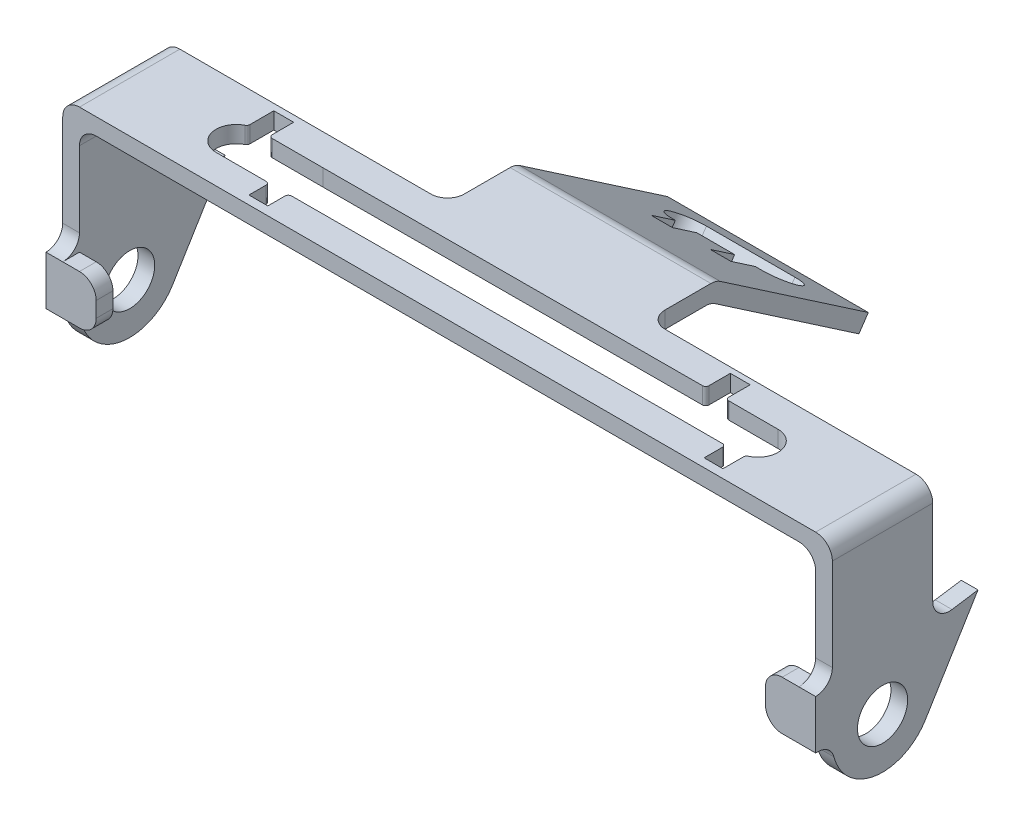
from build123d import *

# Parameters (mm, degrees)
SKETCH1_W           = 220
SKETCH1_H           = 30
BOSS_EXTRUDE1_DEPTH = 5
SKETCH2_W           = 30
SKETCH2_H           = 70
BOSS_EXTRUDE2_DEPTH = 5
CUT_EXTRUDE1_DEPTH  = 10
BOSS_EXTRUDE3_DEPTH = 5
BOSS_EXTRUDE4_DEPTH = 30
FILLET1_R           = 5
SKETCH7_R           = 7.5
CUT_EXTRUDE2_DEPTH  = 253
SKETCH8_W           = 15
SKETCH8_H           = 14.618243145
BOSS_EXTRUDE5_DEPTH = 5
FILLET2_R           = 5
CUT_EXTRUDE3_DEPTH  = 5
SKETCH10_W          = 5.944140112
SKETCH10_H          = 11.167837108
SKETCH10_W_2        = 5.92832961
SKETCH10_H_2        = 9.506983552
CUT_EXTRUDE4_DEPTH  = 5
SKETCH11_W          = 5.623434756
SKETCH11_H          = 8.337110403
SKETCH11_W_2        = 5.64698147
SKETCH11_H_2        = 9.10404701
CUT_EXTRUDE5_DEPTH  = 5
FILLET3_R           = 1
CUT_EXTRUDE6_DEPTH  = 5
SKETCH13_W          = 6.176524638
SKETCH13_H          = 11.481735796
SKETCH13_W_2        = 6.413794009
SKETCH13_H_2        = 10.832022022
CUT_EXTRUDE7_DEPTH  = 5


with BuildPart() as part:
    # Sketch1 → Boss-Extrude1 (new body)
    with BuildSketch(Plane(origin=(0, 0, 0), x_dir=(1, 0, 0), z_dir=(0, 1, 0))):
        Rectangle(SKETCH1_W, SKETCH1_H)
    extrude(amount=BOSS_EXTRUDE1_DEPTH)

    # Sketch2 → Boss-Extrude2 (add)
    with BuildSketch(Plane.ZY.offset(110)):
        with Locations((0, -30)):
            Rectangle(SKETCH2_W, SKETCH2_H)
    boss_extrude2 = extrude(amount=BOSS_EXTRUDE2_DEPTH)

    # Mirror1: Boss-Extrude2 across plane
    add(boss_extrude2.mirror(Plane(origin=(0, 0, 0), x_dir=(0, 0, 1), z_dir=(1, 0, 0))))

    # Sketch4 → Cut-Extrude1 (cut)
    with BuildSketch(Plane.ZY.offset(115)):
        with BuildLine():
            Line((-15, -47.167473829), (-15, -65))
            Line((-15, -65), (15, -65))
            Line((15, -65), (15, -47.167473829))
            ThreePointArc((15, -47.167473829), (0, -62.167473829), (-15, -47.167473829))
        make_face()
    cut_extrude1 = extrude(amount=-CUT_EXTRUDE1_DEPTH, mode=Mode.SUBTRACT)

    # Mirror2: Cut-Extrude1 across plane
    add(cut_extrude1.mirror(Plane(origin=(0, 0, 0), x_dir=(0, 0, 1), z_dir=(1, 0, 0))), mode=Mode.SUBTRACT)

    # Sketch5 → Boss-Extrude3 (add)
    with BuildSketch(Plane(origin=(115, 0, 0), x_dir=(0, 0, -1), z_dir=(1, 0, 0))):
        with BuildLine():
            Line((28.523256762, -29.22115135), (15, -31.288780588))
            Line((15, -31.288780588), (-5.201478884, -40.890888071))
            Line((-5.201478884, -40.890888071), (-4.123987776, -59.07486744))
            Line((-4.123987776, -59.07486744), (0, -62.167473829))
            ThreePointArc((0, -62.167473829), (7.341637998, -60.248007132), (12.804338712, -54.98085403))
            Line((12.804338712, -54.98085403), (28.523256762, -29.22115135))
        make_face()
    boss_extrude3 = extrude(amount=-BOSS_EXTRUDE3_DEPTH)

    # Mirror3: Boss-Extrude3 across plane
    add(boss_extrude3.mirror(Plane(origin=(0, 0, 0), x_dir=(0, 0, 1), z_dir=(1, 0, 0))))

    # Sketch6 → Boss-Extrude4 (add, symmetric)
    with BuildSketch(Plane(origin=(0, 0, 0), x_dir=(0, 0, -1), z_dir=(1, 0, 0))):
        Polygon((12.470905957, 5), (35.245651902, 5), (80.752027939, -26.036386601), (77.934766812, -30.167129844), (33.702918166, 0), (12.470905957, 0), align=None)
    extrude(amount=BOSS_EXTRUDE4_DEPTH, both=True)

    # Fillet1
    fillet1_edges = [part.edges().sort_by_distance(p)[0] for p in [
        (-112.5, -31.288780588, -15),
        (0, 5, -35.245651902),
        (-30, 2.5, -15),
        (0, 0, -33.702918166),
        (30, 2.5, -15),
        (-115, 5, 0),
        (115, 5, 0),
        (-110, 0, 0),
        (110, 0, 0),
        (112.5, -31.288780588, -15),
    ]]
    fillet(fillet1_edges, radius=FILLET1_R)

    # Sketch7 → Cut-Extrude2 (cut)
    with BuildSketch(Plane.ZY.offset(115)):
        with Locations((0, -47.167473829)):
            Circle(SKETCH7_R)
    extrude(amount=-CUT_EXTRUDE2_DEPTH, mode=Mode.SUBTRACT)

    # Sketch8 → Boss-Extrude5 (add)
    with BuildSketch(Plane.XY.offset(15)):
        with Locations((-107.5, -39.858352256)):
            Rectangle(SKETCH8_W, SKETCH8_H)
        with Locations((107.5, -39.858352256)):
            Rectangle(SKETCH8_W, SKETCH8_H)
    extrude(amount=BOSS_EXTRUDE5_DEPTH)

    # Fillet2
    fillet2_edges = [part.edges().sort_by_distance(p)[0] for p in [
        (100, -47.167473829, 17.5),
        (100, -32.549230684, 17.5),
        (112.5, -32.549230684, 15),
        (112.5, -47.167473829, 15),
        (-100, -47.167473829, 17.5),
        (-100, -32.549230684, 17.5),
        (-112.5, -47.167473829, 15),
        (-112.5, -32.549230684, 15),
    ]]
    fillet(fillet2_edges, radius=FILLET2_R - 0.0001)  # a hair under: the kernel refuses the full size

    # Sketch9 → Cut-Extrude3 (cut)
    with BuildSketch(Plane(origin=(0, 5, 0), x_dir=(1, 0, 0), z_dir=(0, 1, 0))):
        with BuildLine():
            Line((-77.846940142, 5.680355486), (-57.846940142, 5.680355486))
            Line((-57.846940142, 5.680355486), (57.752992387, 6))
            Line((57.752992387, 6), (77.752992387, 6))
            ThreePointArc((77.752992387, 6), (83.752992387, 0), (77.752992387, -6))
            Line((77.752992387, -6), (57.752992387, -6))
            Line((57.752992387, -6), (-57.846940142, -6.319644514))
            Line((-57.846940142, -6.319644514), (-77.846940142, -6.319644514))
            ThreePointArc((-77.846940142, -6.319644514), (-83.846940142, -0.319644514), (-77.846940142, 5.680355486))
        make_face()
    extrude(amount=-CUT_EXTRUDE3_DEPTH, mode=Mode.SUBTRACT)

    # Sketch10 → Cut-Extrude4 (cut)
    with BuildSketch(Plane(origin=(0, 5, 0), x_dir=(1, 0, 0), z_dir=(0, 1, 0))):
        with Locations((-77.032885662, 7.498184757)):
            Rectangle(SKETCH10_W, SKETCH10_H)
        with Locations((59.124549755, 8.599122626)):
            Rectangle(SKETCH10_W_2, SKETCH10_H_2)
    extrude(amount=-CUT_EXTRUDE4_DEPTH, mode=Mode.SUBTRACT)

    # Sketch11 → Cut-Extrude5 (cut)
    with BuildSketch(Plane(origin=(0, 5, 0), x_dir=(1, 0, 0), z_dir=(0, 1, 0))):
        with Locations((76.926952234, -8.270502887)):
            Rectangle(SKETCH11_W, SKETCH11_H)
        with Locations((-59.100127848, -7.887034583)):
            Rectangle(SKETCH11_W_2, SKETCH11_H_2)
    extrude(amount=-CUT_EXTRUDE5_DEPTH, mode=Mode.SUBTRACT)

    # Fillet3
    fillet3_edges = [part.edges().sort_by_distance(p)[0] for p in [
        (-80.004955718, 2.5, -5.278834634),
        (62.08871456, 2.5, -6),
        (56.16038495, 2.5, -5.995596293),
        (-74.060815606, 2.5, -5.680355486),
        (-61.923618583, 2.5, 6.319644514),
        (-56.276637113, 2.5, 6.31530248),
        (74.115234856, 2.5, 6),
        (79.738669612, 2.5, 5.661897735),
    ]]
    fillet(fillet3_edges, radius=FILLET3_R)

    # Sketch12 → Cut-Extrude6 (cut)
    with BuildSketch(Plane(origin=(0, 19.819293064, -13.51721001), x_dir=(1, 0, 0), z_dir=(0, 0.8261486486486485, -0.563452225424669))):
        with BuildLine():
            Line((13.839167564, 62.402963996), (-12.615635754, 62.402963996))
            ThreePointArc((-12.615635754, 62.402963996), (-18.615635754, 68.402963996), (-12.615635754, 74.402963996))
            Line((-12.615635754, 74.402963996), (13.839167564, 74.402963996))
            ThreePointArc((13.839167564, 74.402963996), (19.839167564, 68.402963996), (13.839167564, 62.402963996))
        make_face()
    extrude(amount=-CUT_EXTRUDE6_DEPTH, mode=Mode.SUBTRACT)

    # Sketch13 → Cut-Extrude7 (cut)
    with BuildSketch(Plane(origin=(0, 19.819293064, -13.51721001), x_dir=(1, 0, 0), z_dir=(0, 0.8261486486486485, -0.563452225424669))):
        with Locations((8.803081479, 59.323306986)):
            Rectangle(SKETCH13_W, SKETCH13_H)
        with Locations((-8.792921623, 58.998450099)):
            Rectangle(SKETCH13_W_2, SKETCH13_H_2)
    extrude(amount=-CUT_EXTRUDE7_DEPTH, mode=Mode.SUBTRACT)


solid = part.part
